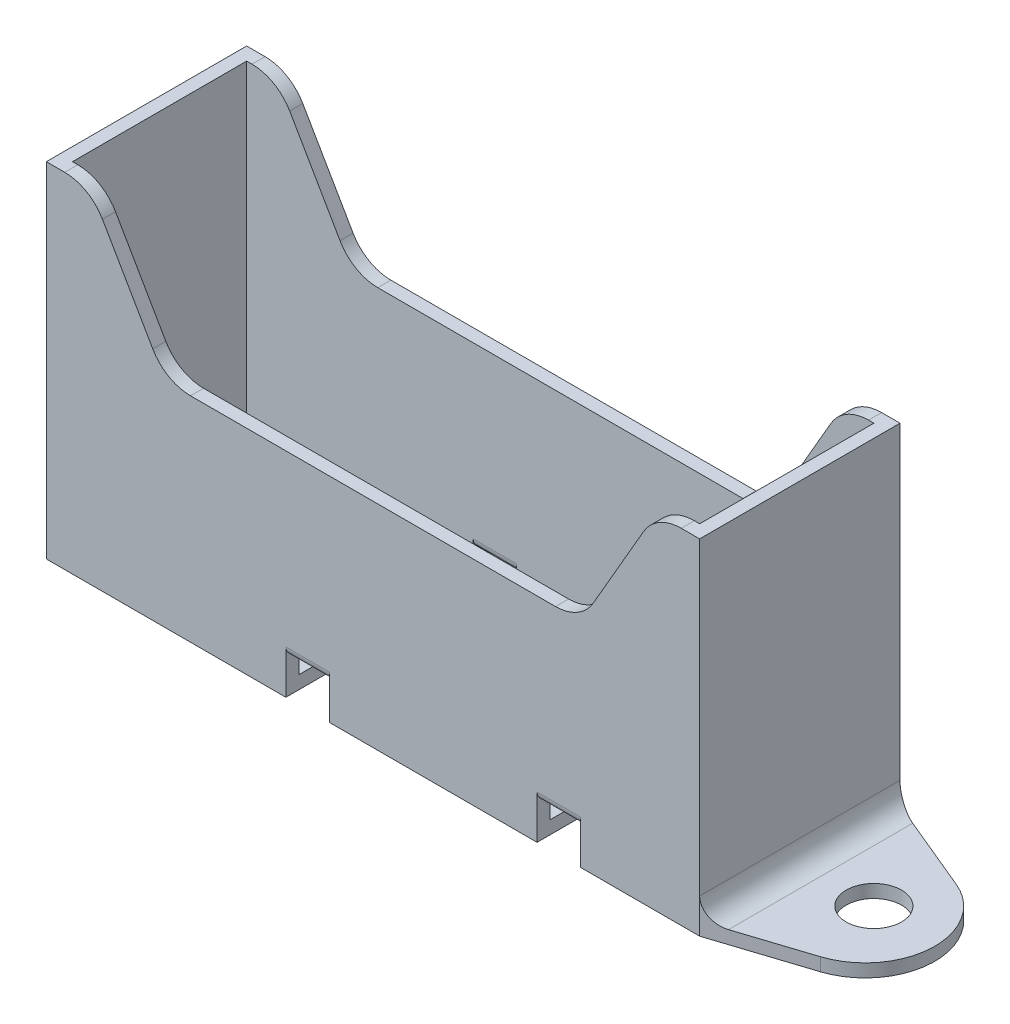
from build123d import *

# Parameters (mm, degrees)
SKETCH15_W                  = 75
SKETCH15_H                  = 23
SKETCH15_W_2                = 72
SKETCH15_H_2                = 20
BOSS_EXTRUDE8_DEPTH         = 38
BOSS_EXTRUDE11_DEPTH        = 1.5
F_1_4_0_25_DIAMETER_HOLE1_D = 6.35
SKETCH21_W                  = 5
SKETCH21_H                  = 4
CUT_EXTRUDE1_DEPTH          = 70.535961919
FILLET1_R                   = 5
FILLET2_R                   = 1
FILLET3_R                   = 2.5


with BuildPart() as part:
    # Sketch15 → Boss-Extrude8 (new body)
    with BuildSketch(Plane(origin=(0, 0, 0), x_dir=(1, 0, 0), z_dir=(0, 1, 0))):
        Rectangle(SKETCH15_W, SKETCH15_H)
        Rectangle(SKETCH15_W_2, SKETCH15_H_2, mode=Mode.SUBTRACT)
    extrude(amount=BOSS_EXTRUDE8_DEPTH)

    # Sketch18 → Boss-Extrude11 (add)
    with BuildSketch(Plane.XZ):
        with BuildLine():
            Line((-37.5, 11.5), (37.5, 11.5))
            Line((37.5, 11.5), (47.964864865, 8.110810811))
            ThreePointArc((47.964864865, 8.110810811), (53.493344425, 0.826258956), (48.576923077, -6.884615385))
            Line((48.576923077, -6.884615385), (37.5, -11.5))
            Line((37.5, -11.5), (-11.354744065, -11.5))
            Line((-11.354744065, -11.5), (-15.970166575, -22.576940483))
            ThreePointArc((-15.970166575, -22.576940483), (-23.354774707, -27.5), (-30.739382839, -22.576940483))
            Line((-30.739382839, -22.576940483), (-35.35480535, -11.5))
            Line((-35.35480535, -11.5), (-37.5, -11.5))
            Line((-37.5, -11.5), (-37.5, 11.5))
        make_face()
    extrude(amount=BOSS_EXTRUDE11_DEPTH)

    # 1/4 (0.25) Diameter Hole1 (through all)
    with Locations(Plane(origin=(0, 0, 0), x_dir=(1, 0, 0), z_dir=(0, 1, 0))):
        with Locations((46, 0), (-23.354774707, 19.5)):
            Hole(F_1_4_0_25_DIAMETER_HOLE1_D / 2)

    # Sketch21 → Cut-Extrude1 (cut, through all)
    with BuildSketch(Plane(origin=(0, 0, -11.5), x_dir=(-1, 0, 0), z_dir=(0, 0, -1))):
        Polygon((-32.5, 38), (-23.839745962, 23), (23.839745962, 23), (32.5, 38), align=None)
        with Locations((-21.339745962, 0.5)):
            Rectangle(SKETCH21_W, SKETCH21_H)
        with Locations((7.5, 0.5)):
            Rectangle(SKETCH21_W, SKETCH21_H)
    extrude(amount=-CUT_EXTRUDE1_DEPTH, mode=Mode.SUBTRACT)

    # Fillet1
    fillet1_edges = [part.edges().sort_by_distance(p)[0] for p in [
        (32.5, 38, -10.75),
        (-32.5, 38, -10.75),
        (-23.839745962, 23, -10.75),
        (23.839745962, 23, -10.75),
        (32.5, 38, 10.75),
        (-32.5, 38, 10.75),
        (-23.839745962, 23, 10.75),
        (23.839745962, 23, 10.75),
    ]]
    fillet(fillet1_edges, radius=FILLET1_R)

    # Fillet2
    # the kernel refuses this fillet: 1 mm, written as the material it takes off along each edge
    with BuildSketch(Plane(origin=(18.839745962, 2.5, -11.5), x_dir=(0, 1, 0), z_dir=(1, 0, 0)), Plane(origin=(23.839745962, 2.5, -10), x_dir=(0, 1, 0), z_dir=(-1, 0, 0)), Plane(origin=(18.839745962, 2.5, 10), x_dir=(0, 1, 0), z_dir=(1, 0, 0)), Plane(origin=(23.839745962, 2.5, 11.5), x_dir=(0, 1, 0), z_dir=(-1, 0, 0)), Plane(origin=(-10, 2.5, -11.5), x_dir=(0, 1, 0), z_dir=(1, 0, 0)), Plane(origin=(-5, 2.5, -10), x_dir=(0, 1, 0), z_dir=(-1, 0, 0)), Plane(origin=(-10, 2.5, 10), x_dir=(0, 1, 0), z_dir=(1, 0, 0)), Plane(origin=(-5, 2.5, 11.5), x_dir=(0, 1, 0), z_dir=(-1, 0, 0))) as fillet2_piece_1:
        with BuildLine():
            CenterArc((FILLET2_R, FILLET2_R), FILLET2_R, 180, 90)
            Line((0, FILLET2_R), (0, 0))
            Line((0, 0), (FILLET2_R, 0))
        make_face()
    extrude(amount=5, mode=Mode.SUBTRACT)

    # Fillet3
    fillet3_edges = [part.edges().sort_by_distance(p)[0] for p in [
        (-23.354774707, 0, -11.5),
        (37.5, 0, 0),
    ]]
    fillet(fillet3_edges, radius=FILLET3_R)


solid = part.part
